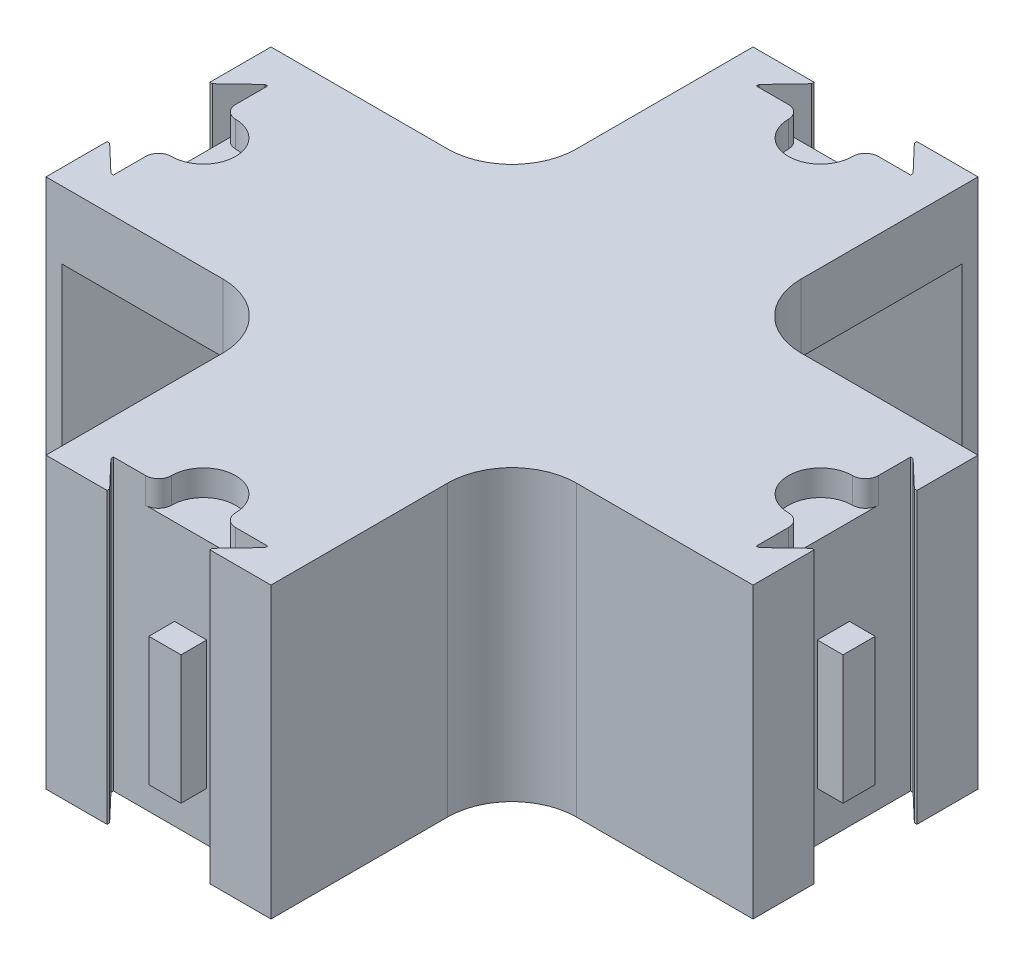
from build123d import *

# Parameters (mm, degrees)
BOSS_EXTRUDE1_DEPTH = 45
CUT_EXTRUDE1_DEPTH  = 34.5
CUT_EXTRUDE2_DEPTH  = 101.750108381
CUT_EXTRUDE3_DEPTH  = 4
CIRPATTERN1_COUNT   = 4
BOSS_EXTRUDE2_DEPTH = 4
CIRPATTERN2_COUNT   = 4


with BuildPart() as part:
    # Sketch1 → Boss-Extrude1 (new body)
    with BuildSketch(Plane(origin=(0, 0, 0), x_dir=(1, 0, 0), z_dir=(0, 1, 0))):
        with BuildLine():
            Line((17.41755235, 71.354805723), (-17.58244765, 71.354805723))
            Line((-17.58244765, 71.354805723), (-17.58244765, 43.854805723))
            ThreePointArc((-17.58244765, 43.854805723), (-20.511379838, 36.783737911), (-27.58244765, 33.854805723))
            Line((-27.58244765, 33.854805723), (-55.08244765, 33.854805723))
            Line((-55.08244765, 33.854805723), (-55.08244765, -1.145194277))
            Line((-55.08244765, -1.145194277), (-27.58244765, -1.145194277))
            ThreePointArc((-27.58244765, -1.145194277), (-20.511379838, -4.074126465), (-17.58244765, -11.145194277))
            Line((-17.58244765, -11.145194277), (-17.58244765, -38.645194277))
            Line((-17.58244765, -38.645194277), (17.41755235, -38.645194277))
            Line((17.41755235, -38.645194277), (17.41755235, -11.145194277))
            ThreePointArc((17.41755235, -11.145194277), (20.346484538, -4.074126465), (27.41755235, -1.145194277))
            Line((27.41755235, -1.145194277), (54.91755235, -1.145194277))
            Line((54.91755235, -1.145194277), (54.91755235, 33.854805723))
            Line((54.91755235, 33.854805723), (27.41755235, 33.854805723))
            ThreePointArc((27.41755235, 33.854805723), (23.590718027, 34.616010398), (20.346484538, 36.783737911))
            ThreePointArc((20.346484538, 36.783737911), (18.178757025, 40.027971399), (17.41755235, 43.854805723))
            Line((17.41755235, 43.854805723), (17.41755235, 71.354805723))
        make_face()
    extrude(amount=BOSS_EXTRUDE1_DEPTH)

    # Sketch1<3> → Cut-Extrude1 (cut)
    with BuildSketch(Plane(origin=(0, 0, 0), x_dir=(1, 0, 0), z_dir=(0, 1, 0))):
        with BuildLine():
            Line((17.41755235, 68.856591392), (-52.584233319, -1.145194277))
            Line((-52.584233319, -1.145194277), (-27.58244765, -1.145194277))
            ThreePointArc((-27.58244765, -1.145194277), (-20.511379838, -4.074126465), (-17.58244765, -11.145194277))
            Line((-17.58244765, -11.145194277), (-17.58244765, -36.146979946))
            Line((-17.58244765, -36.146979946), (52.419338019, 33.854805723))
            Line((52.419338019, 33.854805723), (27.41755235, 33.854805723))
            ThreePointArc((27.41755235, 33.854805723), (23.590718027, 34.616010398), (20.346484538, 36.783737911))
            ThreePointArc((20.346484538, 36.783737911), (18.178757025, 40.027971399), (17.41755235, 43.854805723))
            Line((17.41755235, 43.854805723), (17.41755235, 68.856591392))
        make_face()
    extrude(amount=CUT_EXTRUDE1_DEPTH, mode=Mode.SUBTRACT)

    # Sketch3 → Cut-Extrude2 (cut, through all)
    with BuildSketch(Plane(origin=(0, 45, 0), x_dir=(1, 0, 0), z_dir=(0, 1, 0))):
        Polygon((-55.08244765, 8.354805723), (-54.68244765, 8.354805723), (-50.48244765, 4.354805723), (-50.08244765, 4.354805723), (-50.08244765, 28.354805723), (-50.48244765, 28.354805723), (-54.68244765, 24.354805723), (-55.08244765, 24.354805723), align=None)
    cut_extrude2 = extrude(amount=-CUT_EXTRUDE2_DEPTH, mode=Mode.SUBTRACT)

    # Sketch3<3> → Cut-Extrude3 (cut)
    with BuildSketch(Plane(origin=(0, 45, 0), x_dir=(1, 0, 0), z_dir=(0, 1, 0))):
        with BuildLine():
            Line((-50.08244765, 23.354805754), (-50.08244765, 16.354805723))
            Line((-50.08244765, 16.354805723), (-50.08244765, 9.354805723))
            ThreePointArc((-50.08244765, 9.354805723), (-49.496661212, 10.769019285), (-48.08244765, 11.354805723))
            ThreePointArc((-48.08244765, 11.354805723), (-43.08244765, 16.354805723), (-48.08244765, 21.354805723))
            ThreePointArc((-48.08244765, 21.354805723), (-49.496661223, 21.940592172), (-50.08244765, 23.354805754))
        make_face()
    cut_extrude3 = extrude(amount=-CUT_EXTRUDE3_DEPTH, mode=Mode.SUBTRACT)

    # CirPattern1: Cut-Extrude2, Cut-Extrude3 ×4 about axis
    cirpattern1_axis = Axis((-0.08244765, -2.25, -16.354805723), (0, 1, 0))
    add([cut_extrude2.rotate(cirpattern1_axis, i * 360 / CIRPATTERN1_COUNT) for i in range(1, CIRPATTERN1_COUNT)], mode=Mode.SUBTRACT)
    add([cut_extrude3.rotate(cirpattern1_axis, i * 360 / CIRPATTERN1_COUNT) for i in range(1, CIRPATTERN1_COUNT)], mode=Mode.SUBTRACT)

    # Sketch5 → Boss-Extrude2 (add)
    with BuildSketch(Plane.XY.offset(33.645194277)):
        Polygon((2.41755235, 27.6), (-0.08244765, 27.6), (-2.58244765, 27.6), (-2.58244765, 7.6), (2.41755235, 7.6), align=None)
    boss_extrude2 = extrude(amount=BOSS_EXTRUDE2_DEPTH)

    # CirPattern2: Boss-Extrude2 ×4 about axis
    cirpattern2_axis = Axis((-0.08244765, -2.25, -16.354805723), (0, 1, 0))
    for i in range(1, CIRPATTERN2_COUNT):
        add(boss_extrude2.rotate(cirpattern2_axis, i * 360 / CIRPATTERN2_COUNT))


solid = part.part
